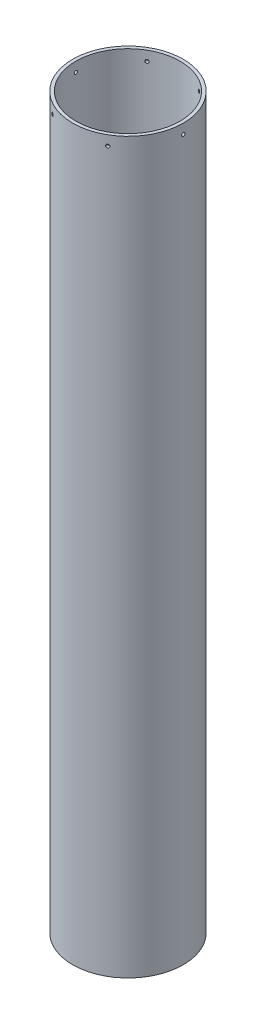
from build123d import *

# Parameters (mm, degrees)
SKETCH1_R           = 53.975
SKETCH1_R_2         = 50.8
BOSS_EXTRUDE1_DEPTH = 711.2
SKETCH2_R           = 1.5875
CUT_EXTRUDE1_DEPTH  = 716.284587594
CIRPATTERN1_COUNT   = 3


with BuildPart() as part:
    # Sketch1 → Boss-Extrude1 (new body)
    with BuildSketch(Plane(origin=(0, 0, 0), x_dir=(1, 0, 0), z_dir=(0, 1, 0))):
        Circle(SKETCH1_R)
        Circle(SKETCH1_R_2, mode=Mode.SUBTRACT)
    extrude(amount=BOSS_EXTRUDE1_DEPTH)

    # Sketch2 → Cut-Extrude1 (cut, symmetric)
    with BuildSketch(Plane(origin=(0, 0, 0), x_dir=(0, 0, -1), z_dir=(1, 0, 0))):
        with Locations((0, 701.675)):
            Circle(SKETCH2_R)
    cut_extrude1 = extrude(amount=CUT_EXTRUDE1_DEPTH, both=True, mode=Mode.SUBTRACT)

    # CirPattern1: Cut-Extrude1 ×3 about axis
    cirpattern1_axis = Axis((0, 711.2, 0), (0, 1, 0))
    for i in range(1, CIRPATTERN1_COUNT):
        add(cut_extrude1.rotate(cirpattern1_axis, i * 360 / CIRPATTERN1_COUNT), mode=Mode.SUBTRACT)


solid = part.part
